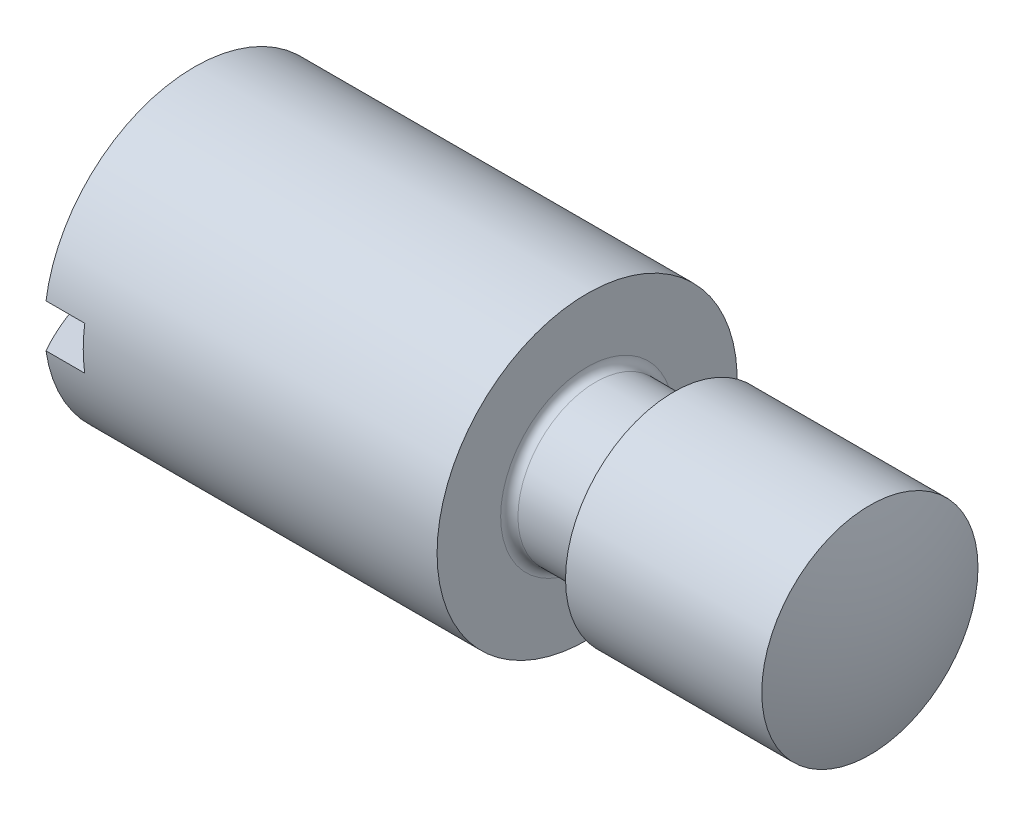
from build123d import *

# Parameters (mm, degrees)
CUT_EXTRUDE1_DEPTH      = 9.847058833
CUT_EXTRUDE1_DEPTH_BACK = 9.847058833
FILLET2_R               = 0.1


with BuildPart() as part:
    # Sketch1 → Revolve1 (revolve)
    with BuildSketch(Plane(origin=(9.966231887, 0, 1.735), x_dir=(1, 0, 0), z_dir=(0, 1, 0))):
        with BuildLine():
            Line((-1.466231887, 1.735), (-9.966231887, 1.735))
            ThreePointArc((-9.966231887, 1.735), (-9.849200212, 2.63251062), (-9.505931708, 3.47))
            Line((-9.505931708, 3.47), (-4.966231887, 3.47))
            Line((-4.966231887, 3.47), (-4.966231887, 2.635))
            Line((-4.966231887, 2.635), (-3.966231887, 2.635))
            Line((-3.966231887, 2.635), (-3.966231887, 2.985))
            Line((-3.966231887, 2.985), (-1.697057679, 2.985))
            ThreePointArc((-1.697057679, 2.985), (-1.524422063, 2.370566784), (-1.466231887, 1.735))
        make_face()
    revolve(axis=Axis((-4.498735189, 0, 0), (1, 0, 0)))

    # Sketch2 → Cut-Extrude1 (cut, two sides: drawn at the far end of the back side and taken through both)
    with BuildSketch(Plane.XY.offset(-CUT_EXTRUDE1_DEPTH_BACK)):
        with BuildLine():
            Line((0.908939853, 0.25), (0.008939989, 0.25))
            ThreePointArc((0.008939989, 0.25), (-0.241060011, 0), (0.008939989, -0.25))
            Line((0.008939989, -0.25), (0.908939853, -0.25))
            Line((0.908939853, -0.25), (0.908939853, 0.25))
        make_face()
    extrude(amount=CUT_EXTRUDE1_DEPTH + CUT_EXTRUDE1_DEPTH_BACK, mode=Mode.SUBTRACT)

    # Fillet2
    fillet2_edges = [part.edges().sort_by_distance(p)[0] for p in [
        (6, 0, 0.9),
        (5, 0, 0.9),
    ]]
    fillet(fillet2_edges, radius=FILLET2_R)


solid = part.part
